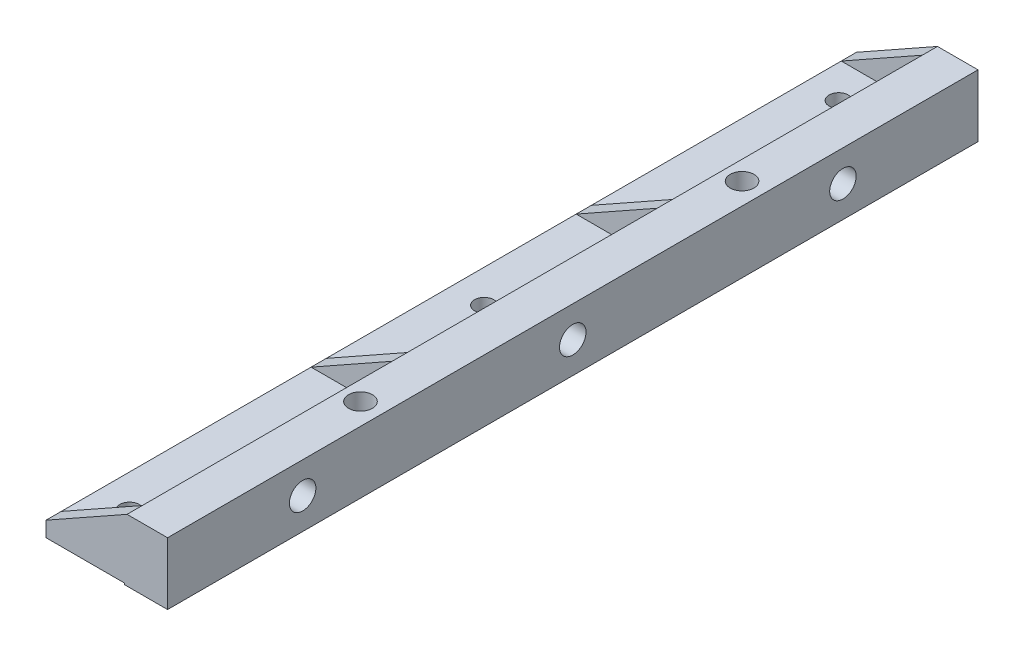
from build123d import *

# Parameters (mm, degrees)
BOSS_EXTRUDE1_DEPTH   = 160
RIB3_REACH            = 111.505
SKETCH4_WALL_W        = 239.367706636
SKETCH4_WALL_H        = 3
RIB4_REACH            = 164.234
SKETCH5_WALL_W        = 344.826356402
SKETCH5_WALL_H        = 3
F_6_CLEARANCE_HOLE1_D = 3.7973
SKETCH18_R            = 2.3495
CUT_EXTRUDE1_DEPTH    = 7.5
SKETCH19_R            = 2.6162
CUT_EXTRUDE2_DEPTH    = 6.35
SKETCH10_R            = 2.3495
CUT_EXTRUDE3_DEPTH    = 163.255727865
SKETCH20_R            = 2.6162
CUT_EXTRUDE4_DEPTH    = 6.35


with BuildPart() as part:
    # Sketch1 → Boss-Extrude1 (new body)
    with BuildSketch(Plane.XY):
        with BuildLine():
            Line((0, 0), (0, 12))
            Line((0, 12), (-8, 12))
            Line((-8, 12), (-8, 6))
            ThreePointArc((-8, 6), (-8.878679656, 3.878679656), (-11, 3))
            Line((-11, 3), (-24, 3))
            Line((-24, 3), (-24, 0))
            Line((-24, 0), (-8.5, 0))
            Line((-8.5, 0), (-8.5, -0.285))
            Line((-8.5, -0.285), (0, -0.285))
            Line((0, -0.285), (0, 0))
        make_face()
    extrude(amount=BOSS_EXTRUDE1_DEPTH)

    # Sketch4 wall → Rib3 (add, up to next)
    with BuildSketch(Plane(origin=(-16, 7.5, 53.83333334), x_dir=(-0.871575537125, -0.490261239633, 0), z_dir=(-0.490261239633, 0.871575537125, 0)), mode=Mode.PRIVATE) as rib3_sk1:
        Rectangle(SKETCH4_WALL_W, SKETCH4_WALL_H)
    rib3_tool1 = extrude(rib3_sk1.sketch, amount=-RIB3_REACH, mode=Mode.PRIVATE) - part.part
    rib3 = rib3_tool1.solids().sort_by_distance((-16, 7.5, 53.83333334))[0]
    add(rib3)

    # Sketch5 wall → Rib4 (add, up to next)
    with BuildSketch(Plane(origin=(-16, 7.5, 0), x_dir=(-0.871575537125, -0.490261239633, 0), z_dir=(-0.490261239633, 0.871575537125, 0)), mode=Mode.PRIVATE) as rib4_sk1:
        with Locations((0, 1.5)):
            Rectangle(SKETCH5_WALL_W, SKETCH5_WALL_H)
    rib4_tool1 = extrude(rib4_sk1.sketch, amount=-RIB4_REACH, mode=Mode.PRIVATE) - part.part
    rib4 = rib4_tool1.solids().sort_by_distance((-16, 7.5, 0))[0]
    add(rib4)

    # Mirror1: Rib3, Rib4 across plane
    add(rib3.mirror(Plane(origin=(0, 0, 80), x_dir=(1, 0, 0), z_dir=(0, 0, -1))))
    add(rib4.mirror(Plane(origin=(0, 0, 80), x_dir=(1, 0, 0), z_dir=(0, 0, -1))))

    # #6 Clearance Hole1 (through all)
    with Locations(Plane(origin=(0, 0, 0), x_dir=(-1, 0, 0), z_dir=(0, -1, 0))):
        with Locations((17.50005, -10), (17.50005, -80), (17.50005, -150)):
            Hole(F_6_CLEARANCE_HOLE1_D / 2)

    # Sketch18 → Cut-Extrude1 (cut)
    with BuildSketch(Plane(origin=(0, 0, 0), x_dir=(0, 0, -1), z_dir=(1, 0, 0))):
        with Locations((-133.333333335, 5.8575)):
            Circle(SKETCH18_R)
        with Locations((-26.666666667, 5.8575)):
            Circle(SKETCH18_R)
        with Locations((-80, 5.8575)):
            Circle(SKETCH18_R)
    extrude(amount=-CUT_EXTRUDE1_DEPTH, mode=Mode.SUBTRACT)

    # Sketch19 → Cut-Extrude2 (cut)
    with BuildSketch(Plane(origin=(0, 0, 0), x_dir=(0, 0, -1), z_dir=(1, 0, 0))):
        with Locations((-133.333333335, 5.8575)):
            Circle(SKETCH19_R)
        with Locations((-26.666666667, 5.8575)):
            Circle(SKETCH19_R)
        with Locations((-80, 5.8575)):
            Circle(SKETCH19_R)
    extrude(amount=-CUT_EXTRUDE2_DEPTH, mode=Mode.SUBTRACT)

    # Sketch10 → Cut-Extrude3 (cut, through all)
    with BuildSketch(Plane(origin=(0, -0.285, 0), x_dir=(-1, 0, 0), z_dir=(0, -1, 0))):
        with Locations((4.250025, -42.33333334)):
            Circle(SKETCH10_R)
        with Locations((4.250025, -117.66666666)):
            Circle(SKETCH10_R)
    extrude(amount=-CUT_EXTRUDE3_DEPTH, mode=Mode.SUBTRACT)

    # Sketch20 → Cut-Extrude4 (cut)
    with BuildSketch(Plane.XZ.offset(0.285)):
        with Locations((-4.250025, 117.66666666)):
            Circle(SKETCH20_R)
        with Locations((-4.250025, 42.33333334)):
            Circle(SKETCH20_R)
    extrude(amount=-CUT_EXTRUDE4_DEPTH, mode=Mode.SUBTRACT)


solid = part.part
